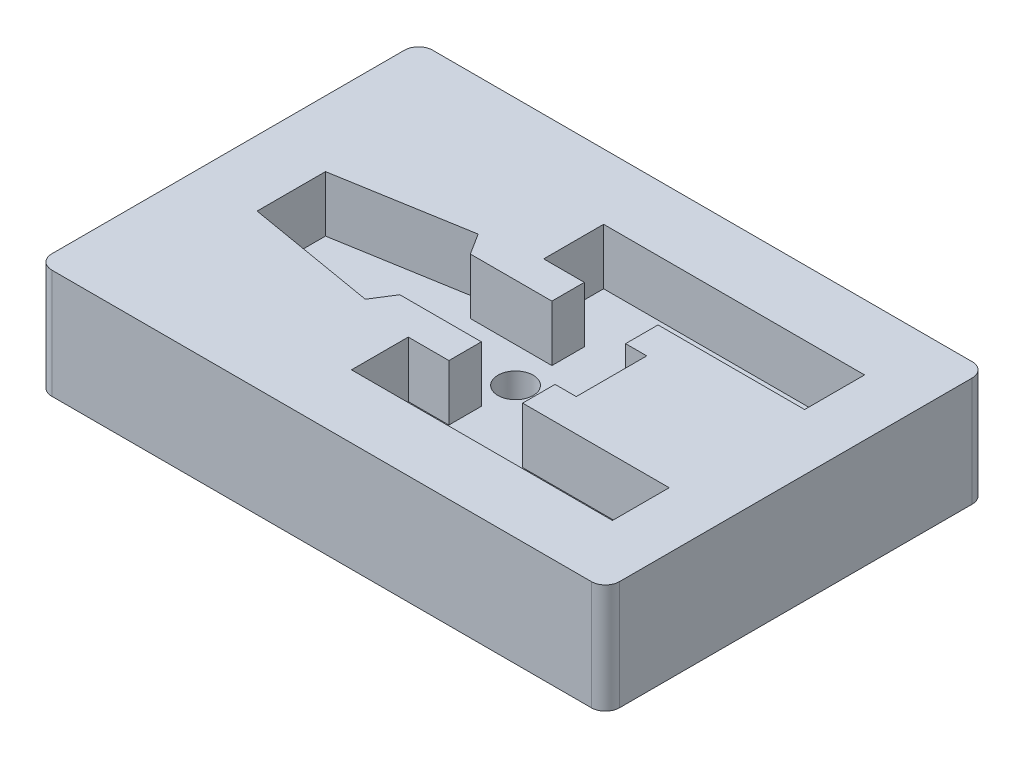
from build123d import *

# Parameters (mm, degrees)
SKETCH1_W           = 84.5
SKETCH1_H           = 54
BOSS_EXTRUDE2_DEPTH = 15.5
FILLET1_R           = 2
Y_WING_START        = -26.76167351
Y_WING_DEPTH        = 8
Y_WING_START_2      = -32.76167351
Y_WING_2_OUTLINE_R  = 2.5
Y_WING_2_DEPTH      = 6
SKETCH2_W           = 80.5
SKETCH2_H           = 50
CUT_EXTRUDE1_DEPTH  = 13.5
SKETCH3_W           = 2.008539682
SKETCH3_H           = 5.255332567
SKETCH3_H_2         = 4.996733938
BOSS_EXTRUDE3_DEPTH = 13.5
SKETCH4_R           = 4.5
CUT_EXTRUDE2_DEPTH  = 5
SKETCH5_W           = 2
SKETCH5_H           = 54
CUT_EXTRUDE3_DEPTH  = 15.5
SKETCH6_W           = 2
SKETCH6_H           = 50
BOSS_EXTRUDE4_DEPTH = 13.5
FILLET2_R           = 2


with BuildPart() as part:
    # Sketch1 → Boss-Extrude2 (new body)
    with BuildSketch(Plane(origin=(0, 0, 0), x_dir=(1, 0, 0), z_dir=(0, 1, 0))):
        with Locations((42.25, 27)):
            Rectangle(SKETCH1_W, SKETCH1_H)
    extrude(amount=BOSS_EXTRUDE2_DEPTH)

    # Fillet1
    fillet1_edges = [part.edges().sort_by_distance(p)[0] for p in [
        (0, 7.75, -54),
        (84.5, 7.75, -54),
        (84.5, 7.75, 0),
        (0, 7.75, 0),
    ]]
    fillet(fillet1_edges, radius=FILLET1_R)


with BuildPart() as body_2:
    # Y-Wing: read off the stored shape, not the designer's step
    # Y-Wing outline → Y-Wing (new body)
    with BuildSketch(Plane(origin=(0, 0, 0), x_dir=(1, 0, 0), z_dir=(0, 1, 0)).offset(Y_WING_START)):
        Polygon((-37.998848216, 80.77793428), (-49.561243891, 80.77793428), (-51.452110178, 83.77793428), (-69.950345376, 80.625586413), (-69.950345376, 70.93293428), (-51.452110178, 67.77793428), (-49.561243891, 70.77793428), (-37.998848216, 70.77793428), (-37.998848216, 66.17793428), (-43.764531914, 66.17793428), (-43.764531914, 58.130000785), (-6.764531914, 58.130000785), (-6.764531914, 66.17793428), (-27.548546514, 66.17793428), (-27.548546514, 70.77793428), (-24.545586254, 70.77793428), (-24.545586254, 80.77793428), (-27.548546514, 80.77793428), (-27.548546514, 85.37793428), (-6.764531914, 85.37793428), (-6.764531914, 93.87793428), (-43.764531914, 93.87793428), (-43.764531914, 85.37793428), (-37.998848216, 85.37793428), align=None)
    extrude(amount=Y_WING_DEPTH)

    # Y-Wing 2 outline → Y-Wing 2 (add)
    with BuildSketch(Plane(origin=(0, 0, 0), x_dir=(1, 0, 0), z_dir=(0, 1, 0)).offset(Y_WING_START_2)):
        with Locations((-38.150345376, 75.778331613)):
            Circle(Y_WING_2_OUTLINE_R)
    extrude(amount=Y_WING_2_DEPTH)


with BuildPart() as body_2_1:
    # Body-Move/Copy3: moved
    add(body_2.part.moved(Location((81.260162004, 34.341820547, 49.133266847))))


with BuildPart() as part_1:
    add(part.part)

    # Intersect1: read off the stored shape, not the designer's step
    # Intersect1: cut body 2
    add(body_2_1.part, mode=Mode.SUBTRACT)

    # Sketch2 → Cut-Extrude1 (cut)
    with BuildSketch(Plane.XZ):
        with Locations((42.25, -27)):
            Rectangle(SKETCH2_W, SKETCH2_H)
        Polygon((30.788040431, -16.448642605), (33.204506118, -20.282545146), (41.261313787, -20.282545146), (41.261313787, -19.044667433), (35.495630089, -19.044667433), (35.495630089, -6.996733938), (76.495630089, -6.996733938), (76.495630089, -19.044667433), (55.71161549, -19.044667433), (55.71161549, -19.644667433), (58.714575749, -19.644667433), (58.714575749, -33.644667433), (55.71161549, -33.644667433), (55.71161549, -34.244667433), (76.495630089, -34.244667433), (76.495630089, -46.744667433), (35.495630089, -46.744667433), (35.495630089, -34.244667433), (41.261313787, -34.244667433), (41.261313787, -33.644667433), (36.074948333, -33.644667433), (32.802458964, -33.644667433), (30.788147827, -36.840521868), (9.309816627, -33.180325595), (9.309816627, -20.111899958), align=None, mode=Mode.SUBTRACT)
    extrude(amount=-CUT_EXTRUDE1_DEPTH, mode=Mode.SUBTRACT)

    # Sketch3 → Boss-Extrude3 (add)
    with BuildSketch(Plane.XZ.offset(-13.5)):
        Polygon((2, -27), (2, -28.000523913), (9.309816627, -28.000523913), (9.309816627, -27), (9.309816627, -26.003783182), (2, -26.003783182), align=None)
        with Locations((36.49989993, -49.372333717)):
            Rectangle(SKETCH3_W, SKETCH3_H)
        Polygon((76.495630089, -40.494667433), (76.495630089, -39.49850229), (82.5, -39.49850229), (82.5, -40.494667433), (82.5, -41.494277076), (76.495630089, -41.494277076), align=None)
        Polygon((76.495630089, -13.020700685), (76.495630089, -14.018243481), (82.5, -14.018243481), (82.5, -13.020700685), (82.5, -12.020776308), (76.495630089, -12.020776308), align=None)
        with Locations((36.49989993, -4.498366969)):
            Rectangle(SKETCH3_W, SKETCH3_H_2)
    extrude(amount=BOSS_EXTRUDE3_DEPTH)

    # Sketch4 → Cut-Extrude2 (cut)
    with BuildSketch(Plane.XZ):
        Polygon((9.309816627, -20.111899958), (30.788040431, -16.448642605), (33.204506118, -20.282545146), (41.261313787, -20.282545146), (41.261313787, -19.044667433), (35.495630089, -19.044667433), (35.495630089, -6.996733938), (76.495630089, -6.996733938), (76.495630089, -19.044667433), (55.71161549, -19.044667433), (55.71161549, -19.644667433), (58.714575749, -19.644667433), (58.714575749, -33.644667433), (55.71161549, -33.644667433), (55.71161549, -34.244667433), (76.495630089, -34.244667433), (76.495630089, -46.744667433), (35.495630089, -46.744667433), (35.495630089, -34.244667433), (41.261313787, -34.244667433), (41.261313787, -33.644667433), (32.802458964, -33.644667433), (30.788147827, -36.840521868), (9.309816627, -33.180325595), align=None)
        with Locations(Location((43.109816627, -26.645064766, 0), (0, 0, 270))):
            Circle(SKETCH4_R, mode=Mode.SUBTRACT)
    extrude(amount=-CUT_EXTRUDE2_DEPTH, mode=Mode.SUBTRACT)

    # Sketch5 → Cut-Extrude3 (cut)
    with BuildSketch(Plane(origin=(0, 0, 0), x_dir=(-1, 0, 0), z_dir=(0, -1, 0))):
        with Locations((-1, 27)):
            Rectangle(SKETCH5_W, SKETCH5_H)
        with Locations((-83.5, 27)):
            Rectangle(SKETCH5_W, SKETCH5_H)
    extrude(amount=-CUT_EXTRUDE3_DEPTH, mode=Mode.SUBTRACT)

    # Sketch6 → Boss-Extrude4 (add)
    with BuildSketch(Plane(origin=(0, 13.5, 0), x_dir=(-1, 0, 0), z_dir=(0, -1, 0))):
        with Locations((-3, 27)):
            Rectangle(SKETCH6_W, SKETCH6_H)
        with Locations((-81.5, 27)):
            Rectangle(SKETCH6_W, SKETCH6_H)
    extrude(amount=BOSS_EXTRUDE4_DEPTH)

    # Fillet2
    fillet2_edges = [part_1.edges().sort_by_distance(p)[0] for p in [
        (82.5, 7.75, -54),
        (2, 7.75, -54),
        (82.5, 7.75, 0),
        (2, 7.75, 0),
        (4, 6.75, -52),
        (4, 6.75, -2),
        (80.5, 6.75, -2),
        (80.5, 6.75, -52),
    ]]
    fillet(fillet2_edges, radius=FILLET2_R)


solid = part_1.part
